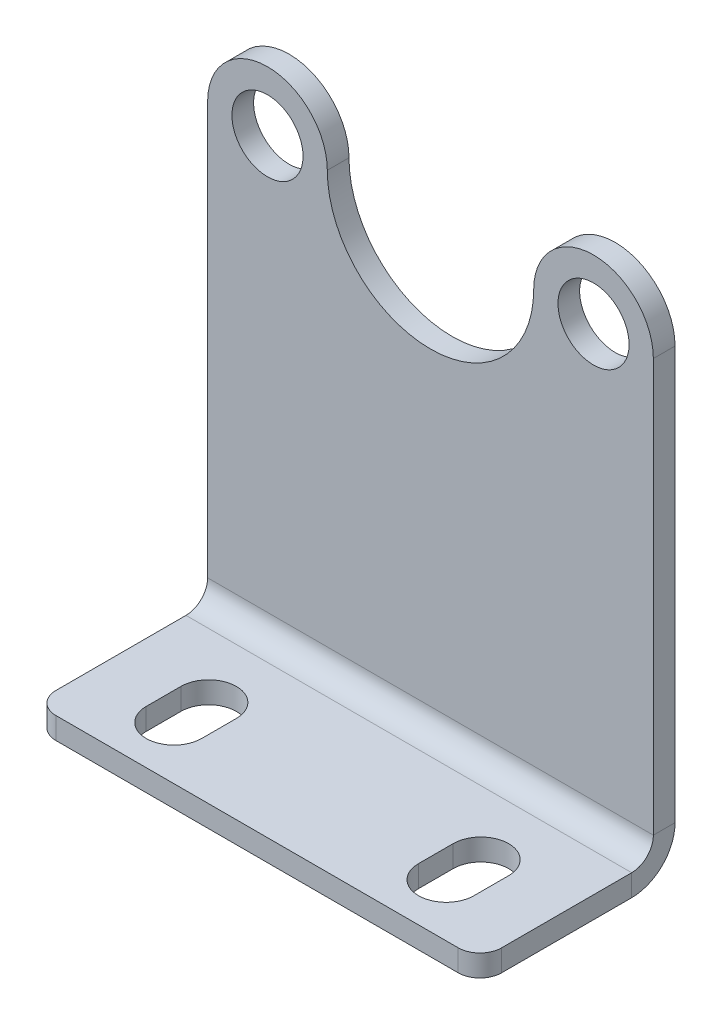
from build123d import *

# Parameters (mm, degrees)
SKETCH1_R              = 5.207
BOSS_EXTRUDE1_DEPTH    = 3.175
SKETCH2_W              = 65.278
SKETCH2_H              = 25.4
BOSS_EXTRUDE2_DEPTH    = 3.175
FILLET1_R              = 3.175
CONVERT_SOLID1_DEPTH   = 65.278
CONVERT_SOLID1_2_DEPTH = 65.278


# Read off the part's stored shape, not the designer's step: Convert-Solid1
with BuildPart() as part:
    # Sketch1 → Boss-Extrude1 (new body)
    with BuildSketch(Plane.XY):
        with BuildLine():
            Line((0, 0), (65.278, 0))
            Line((65.278, 0), (65.278, 66.802))
            ThreePointArc((65.278, 66.802), (56.515, 75.565), (47.752, 66.802))
            ThreePointArc((47.752, 66.802), (32.639, 51.689), (17.526, 66.802))
            ThreePointArc((17.526, 66.802), (8.763, 75.565), (0, 66.802))
            Line((0, 66.802), (0, 0))
        make_face()
        with Locations((8.763, 66.802)):
            Circle(SKETCH1_R, mode=Mode.SUBTRACT)
        with Locations((56.515, 66.802)):
            Circle(SKETCH1_R, mode=Mode.SUBTRACT)
    extrude(amount=BOSS_EXTRUDE1_DEPTH)

    # Sketch2 → Boss-Extrude2 (add)
    with BuildSketch(Plane(origin=(0, 0, 0), x_dir=(1, 0, 0), z_dir=(0, 1, 0))):
        with Locations((32.639, -15.875)):
            Rectangle(SKETCH2_W, SKETCH2_H)
        with BuildLine():
            Line((16.764, -15.73022), (16.764, -20.81022))
            ThreePointArc((16.764, -20.81022), (12.7, -24.87422), (8.636, -20.81022))
            Line((8.636, -20.81022), (8.636, -15.73022))
            ThreePointArc((8.636, -15.73022), (12.7, -11.66622), (16.764, -15.73022))
        make_face(mode=Mode.SUBTRACT)
        with BuildLine():
            Line((48.514, -15.73022), (48.514, -20.81022))
            ThreePointArc((48.514, -20.81022), (52.578, -24.87422), (56.642, -20.81022))
            Line((56.642, -20.81022), (56.642, -15.73022))
            ThreePointArc((56.642, -15.73022), (52.578, -11.66622), (48.514, -15.73022))
        make_face(mode=Mode.SUBTRACT)
    extrude(amount=BOSS_EXTRUDE2_DEPTH)

    # Fillet1
    fillet1_edges = [part.edges().sort_by_distance(p)[0] for p in [
        (0, 1.5875, 28.575),
        (65.278, 1.5875, 28.575),
    ]]
    fillet(fillet1_edges, radius=FILLET1_R)

    # Convert-Solid1 outline → Convert-Solid1 (cut)
    with BuildSketch(Plane.YZ):
        with BuildLine():
            ThreePointArc((6.35, 0), (1.859871939, 1.859871939), (0, 6.35))
            Line((0, 6.35), (0, 0))
            Line((0, 0), (6.35, 0))
        make_face()
    extrude(amount=CONVERT_SOLID1_DEPTH, mode=Mode.SUBTRACT)

    # Convert-Solid1 2 outline → Convert-Solid1 2 (add)
    with BuildSketch(Plane.YZ):
        with BuildLine():
            ThreePointArc((6.35, 3.175), (4.10493597, 4.10493597), (3.175, 6.35))
            Line((3.175, 6.35), (3.175, 3.175))
            Line((3.175, 3.175), (6.35, 3.175))
        make_face()
    extrude(amount=CONVERT_SOLID1_2_DEPTH)


solid = part.part
